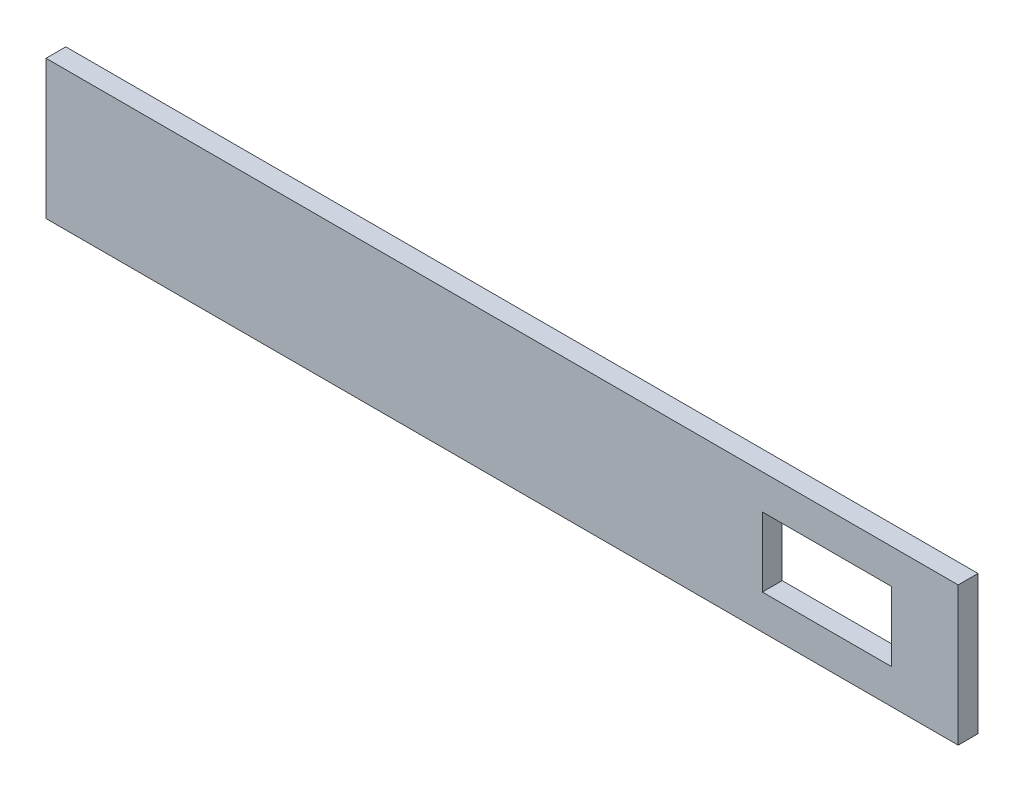
from build123d import *

# Parameters (mm, degrees)
SKETCH1_W           = 292.1
SKETCH1_H           = 44.45
BOSS_EXTRUDE1_DEPTH = 6.35
SKETCH2_W           = 41.275
SKETCH2_H           = 22.225
CUT_EXTRUDE1_DEPTH  = 252.099132245


with BuildPart() as part:
    # Sketch1 → Boss-Extrude1 (new body)
    with BuildSketch(Plane.XY):
        with Locations((-103.983, 0)):
            Rectangle(SKETCH1_W, SKETCH1_H)
    extrude(amount=BOSS_EXTRUDE1_DEPTH)

    # Sketch2 → Cut-Extrude1 (cut, through all)
    with BuildSketch(Plane.XY.offset(6.35)):
        Rectangle(SKETCH2_W, SKETCH2_H)
    extrude(amount=-CUT_EXTRUDE1_DEPTH, mode=Mode.SUBTRACT)


solid = part.part
